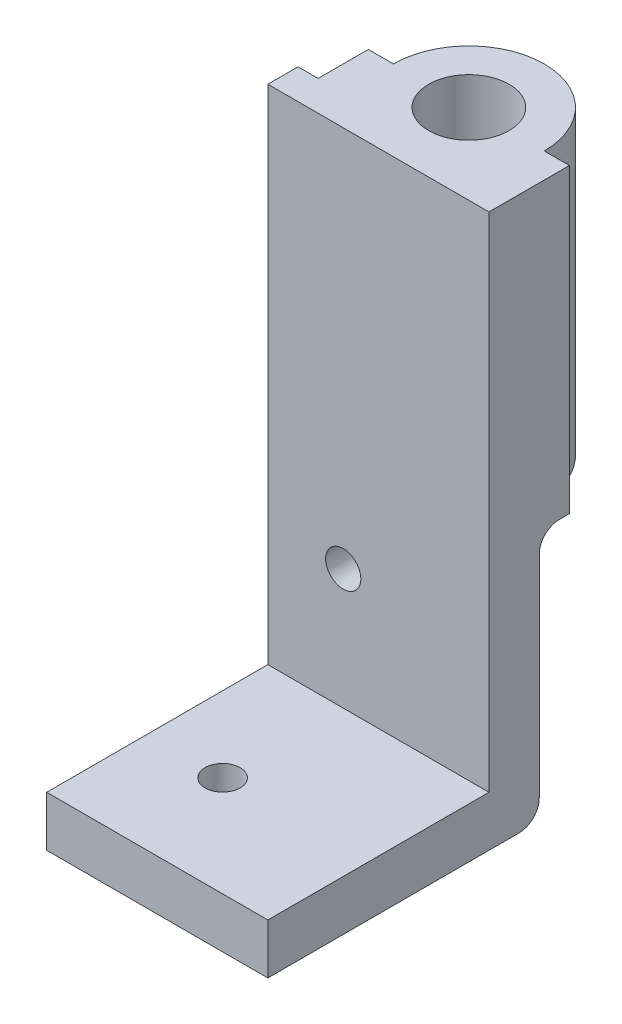
from build123d import *

# Parameters (mm, degrees)
SKETCH1_W           = 22
SKETCH1_H           = 53
BOSS_EXTRUDE1_DEPTH = 3
SKETCH2_W           = 22
SKETCH2_H           = 3
BOSS_EXTRUDE2_DEPTH = 22
SKETCH3_R           = 1.75
CUT_EXTRUDE1_DEPTH  = 22
SKETCH4_R           = 1.75
CUT_EXTRUDE2_DEPTH  = 63.593929418
SKETCH5_W           = 20
SKETCH5_H           = 30
BOSS_EXTRUDE3_DEPTH = 5
BOSS_EXTRUDE4_DEPTH = 30
SKETCH7_R           = 4
CUT_EXTRUDE3_DEPTH  = 20
BOSS_EXTRUDE5_START = 1
SKETCH8_W           = 22
SKETCH8_H           = 23
SKETCH8_R           = 1.75
BOSS_EXTRUDE5_DEPTH = 1
BOSS_EXTRUDE6_START = 1
SKETCH9_W           = 22
SKETCH9_H           = 26
SKETCH9_R           = 1.75
BOSS_EXTRUDE6_DEPTH = 1
BOSS_EXTRUDE7_START = 1
SKETCH10_W          = 22
SKETCH10_H          = 26
SKETCH10_R          = 1.75
BOSS_EXTRUDE7_DEPTH = 1
BOSS_EXTRUDE8_START = 1
SKETCH11_W          = 22
SKETCH11_H          = 25
SKETCH11_R          = 1.75
BOSS_EXTRUDE8_DEPTH = 1
FILLET1_R           = 2
FILLET2_R           = 2


with BuildPart() as part:
    # Sketch1 → Boss-Extrude1 (new body)
    with BuildSketch(Plane.XY):
        with Locations((11, 26.5)):
            Rectangle(SKETCH1_W, SKETCH1_H)
    extrude(amount=BOSS_EXTRUDE1_DEPTH)

    # Sketch2 → Boss-Extrude2 (add)
    with BuildSketch(Plane.XY.offset(3)):
        with Locations((11, 1.5)):
            Rectangle(SKETCH2_W, SKETCH2_H)
    extrude(amount=BOSS_EXTRUDE2_DEPTH)

    # Sketch3 → Cut-Extrude1 (cut)
    with BuildSketch(Plane.XZ):
        with Locations(Location((7.5, 15, 0), (0, 0, 270))):
            Circle(SKETCH3_R)
    extrude(amount=-CUT_EXTRUDE1_DEPTH, mode=Mode.SUBTRACT)

    # Sketch4 → Cut-Extrude2 (cut, through all)
    with BuildSketch(Plane(origin=(0, 0, 0), x_dir=(-1, 0, 0), z_dir=(0, 0, -1))):
        with Locations((-7.5, 15)):
            Circle(SKETCH4_R)
    extrude(amount=-CUT_EXTRUDE2_DEPTH, mode=Mode.SUBTRACT)

    # Sketch5 → Boss-Extrude3 (add)
    with BuildSketch(Plane(origin=(0, 0, 0), x_dir=(-1, 0, 0), z_dir=(0, 0, -1))):
        with Locations((-12, 38)):
            Rectangle(SKETCH5_W, SKETCH5_H)
    extrude(amount=BOSS_EXTRUDE3_DEPTH)

    # Sketch6 → Boss-Extrude4 (add)
    with BuildSketch(Plane.XZ.offset(-23)):
        with BuildLine():
            Line((19.5, -5), (4.5, -5))
            ThreePointArc((4.5, -5), (12, -12.5), (19.5, -5))
        make_face()
    extrude(amount=-BOSS_EXTRUDE4_DEPTH)

    # Sketch7 → Cut-Extrude3 (cut)
    with BuildSketch(Plane(origin=(0, 53, 0), x_dir=(1, 0, 0), z_dir=(0, 1, 0))):
        with Locations(Location((12, 5, 0), (0, 0, 270))):
            Circle(SKETCH7_R)
    extrude(amount=-CUT_EXTRUDE3_DEPTH, mode=Mode.SUBTRACT)

    # Sketch8 → Boss-Extrude5 (add)
    with BuildSketch(Plane(origin=(0, 0, 0), x_dir=(-1, 0, 0), z_dir=(0, 0, -1)).offset(BOSS_EXTRUDE5_START)):
        with Locations((-11, 11.5)):
            Rectangle(SKETCH8_W, SKETCH8_H)
        with Locations((-7.5, 15)):
            Circle(SKETCH8_R, mode=Mode.SUBTRACT)
    extrude(amount=-BOSS_EXTRUDE5_DEPTH)

    # Sketch9 → Boss-Extrude6 (add)
    with BuildSketch(Plane.XZ.offset(BOSS_EXTRUDE6_START)):
        with Locations((11, 12)):
            Rectangle(SKETCH9_W, SKETCH9_H)
        with Locations(Location((7.5, 15, 0), (0, 0, 270))):
            Circle(SKETCH9_R, mode=Mode.SUBTRACT)
    extrude(amount=-BOSS_EXTRUDE6_DEPTH)

    # Sketch10 → Boss-Extrude7 (add)
    with BuildSketch(Plane(origin=(0, -1, 0), x_dir=(-1, 0, 0), z_dir=(0, -1, 0)).offset(BOSS_EXTRUDE7_START)):
        with Locations((-11, -12)):
            Rectangle(SKETCH10_W, SKETCH10_H)
        with Locations(Location((-7.5, -15, 0), (0, 0, 90))):
            Circle(SKETCH10_R, mode=Mode.SUBTRACT)
    extrude(amount=-BOSS_EXTRUDE7_DEPTH)

    # Sketch11 → Boss-Extrude8 (add)
    with BuildSketch(Plane(origin=(0, 0, -1), x_dir=(-1, 0, 0), z_dir=(0, 0, -1)).offset(BOSS_EXTRUDE8_START)):
        with Locations((-11, 10.5)):
            Rectangle(SKETCH11_W, SKETCH11_H)
        with Locations((-7.5, 15)):
            Circle(SKETCH11_R, mode=Mode.SUBTRACT)
    extrude(amount=-BOSS_EXTRUDE8_DEPTH)

    # Fillet1
    fillet1_edges = [part.edges().sort_by_distance(p)[0] for p in [
        (11, -2, -2),
    ]]
    fillet(fillet1_edges, radius=FILLET1_R)

    # Fillet2
    fillet2_edges = [part.edges().sort_by_distance(p)[0] for p in [
        (12, 23, -2),
    ]]
    fillet(fillet2_edges, radius=FILLET2_R)


solid = part.part
